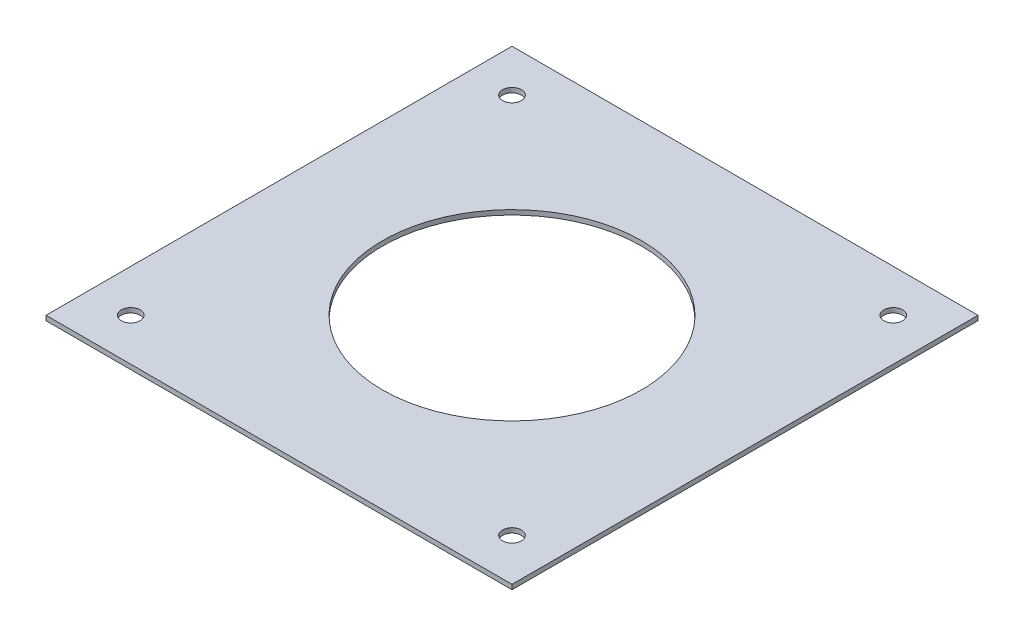
from build123d import *

# Parameters (mm, degrees)
SKETCH1_W           = 98.782817332
SKETCH1_H           = 98.782817332
BOSS_EXTRUDE1_DEPTH = 1.000000032
SKETCH3_R           = 2.000000064
CUT_EXTRUDE2_DEPTH  = 70.85715783
SKETCH8_R           = 27.432
CUT_EXTRUDE9_DEPTH  = 70.85715783


with BuildPart() as part:
    # Sketch1 → Boss-Extrude1 (new body)
    with BuildSketch(Plane(origin=(0, 0, 0), x_dir=(1, 0, 0), z_dir=(0, 1, 0))):
        Rectangle(SKETCH1_W, SKETCH1_H)
    extrude(amount=BOSS_EXTRUDE1_DEPTH)

    # Sketch3 → Cut-Extrude2 (cut, through all)
    with BuildSketch(Plane(origin=(0, 0, 0), x_dir=(1, 0, 0), z_dir=(0, 1, 0))):
        with Locations((40.411152545, 40.411152545)):
            Circle(SKETCH3_R)
        with Locations((40.411152545, -40.411152545)):
            Circle(SKETCH3_R)
        with Locations((-40.411152545, -40.411152545)):
            Circle(SKETCH3_R)
        with Locations((-40.411152545, 40.411152545)):
            Circle(SKETCH3_R)
    extrude(amount=CUT_EXTRUDE2_DEPTH, mode=Mode.SUBTRACT)

    # Sketch8 → Cut-Extrude9 (cut, through all)
    with BuildSketch(Plane(origin=(0, 0, 0), x_dir=(1, 0, 0), z_dir=(0, 1, 0))):
        Circle(SKETCH8_R)
    extrude(amount=CUT_EXTRUDE9_DEPTH, mode=Mode.SUBTRACT)


solid = part.part
